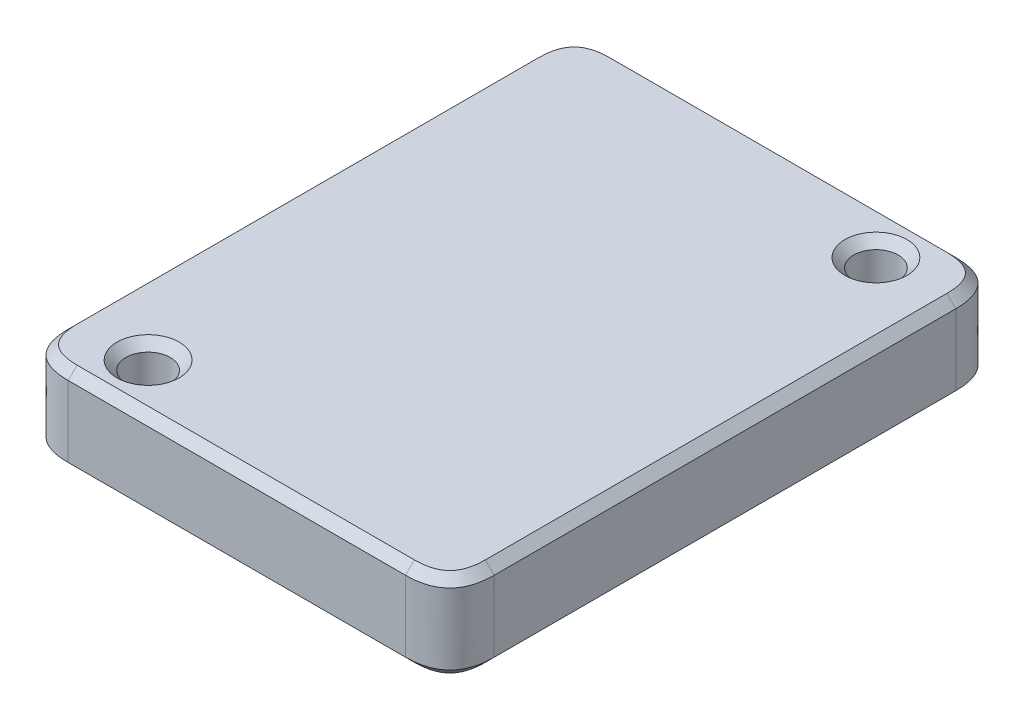
from build123d import *

# Parameters (mm, degrees)
SKETCH1_W                    = 48
SKETCH1_H                    = 62
BOSS_EXTRUDE1_DEPTH          = 10
SKETCH2_R                    = 3.5
CUT_EXTRUDE2_DEPTH           = 1
CUT_EXTRUDE2_DRAFT           = -45
CUT_EXTRUDE2_PROFILE_2_DEPTH = 1
CUT_EXTRUDE2_PROFILE_2_DRAFT = -45
SKETCH4_R                    = 3.5
CUT_EXTRUDE3_DEPTH           = 1
CUT_EXTRUDE3_DRAFT           = -45
CUT_EXTRUDE3_PROFILE_2_DEPTH = 1
CUT_EXTRUDE3_PROFILE_2_DRAFT = -45
SKETCH5_R                    = 2.5
CUT_EXTRUDE4_DEPTH           = 41.459856648
FILLET4_SIZE                 = 5
FILLET5_SIZE                 = 5
FILLET6_SIZE                 = 5
FILLET7_SIZE                 = 5
CHAMFER4_SIZE                = 1
CHAMFER5_SIZE                = 1


with BuildPart() as part:
    # Sketch1 → Boss-Extrude1 (new body)
    with BuildSketch(Plane(origin=(0, 0, 0), x_dir=(1, 0, 0), z_dir=(0, 1, 0))):
        Rectangle(SKETCH1_W, SKETCH1_H)
    extrude(amount=BOSS_EXTRUDE1_DEPTH)


with BuildPart() as cut_extrude2_tool:
    # Sketch2 → Cut-Extrude2 (with draft: the straight prism first)
    with BuildSketch(Plane(origin=(0, 10, 0), x_dir=(1, 0, 0), z_dir=(0, 1, 0))):
        with Locations((15.5, 25.5)):
            Circle(SKETCH2_R)
    extrude(amount=-CUT_EXTRUDE2_DEPTH)
    # Cut-Extrude2: the draft: its side faces are tilted about the plane it starts from
    cut_extrude2_sides = [cut_extrude2_tool.faces().sort_by_distance(p)[0] for p in [
        (12, 9.5, -25.5),
    ]]
    draft(cut_extrude2_sides, Plane(origin=(0, 10, 0), x_dir=(1, 0, 0), z_dir=(0, 1, 0)), CUT_EXTRUDE2_DRAFT)


with BuildPart() as part_1:
    add(part.part)

    # Cut-Extrude2: cut by cut_extrude2_tool
    add(cut_extrude2_tool.part, mode=Mode.SUBTRACT)


with BuildPart() as cut_extrude2_profile_2_tool:
    # Sketch2 → Cut-Extrude2 profile 2 (with draft: the straight prism first)
    with BuildSketch(Plane(origin=(0, 10, 0), x_dir=(1, 0, 0), z_dir=(0, 1, 0))):
        with Locations((-15.5, -25.5)):
            Circle(SKETCH2_R)
    extrude(amount=-CUT_EXTRUDE2_PROFILE_2_DEPTH)
    # Cut-Extrude2 profile 2: the draft: its side faces are tilted about the plane it starts from
    cut_extrude2_profile_2_sides = [cut_extrude2_profile_2_tool.faces().sort_by_distance(p)[0] for p in [
        (-19, 9.5, 25.5),
    ]]
    draft(cut_extrude2_profile_2_sides, Plane(origin=(0, 10, 0), x_dir=(1, 0, 0), z_dir=(0, 1, 0)), CUT_EXTRUDE2_PROFILE_2_DRAFT)


with BuildPart() as part_2:
    add(part_1.part)

    # Cut-Extrude2 profile 2: cut by cut_extrude2_profile_2_tool
    add(cut_extrude2_profile_2_tool.part, mode=Mode.SUBTRACT)


with BuildPart() as cut_extrude3_tool:
    # Sketch4 → Cut-Extrude3 (with draft: the straight prism first)
    with BuildSketch(Plane.XZ):
        with Locations((-15.5, 25.5)):
            Circle(SKETCH4_R)
    extrude(amount=-CUT_EXTRUDE3_DEPTH)
    # Cut-Extrude3: the draft: its side faces are tilted about the plane it starts from
    cut_extrude3_sides = [cut_extrude3_tool.faces().sort_by_distance(p)[0] for p in [
        (-19, 0.5, 25.5),
    ]]
    draft(cut_extrude3_sides, Plane.XZ, CUT_EXTRUDE3_DRAFT)


with BuildPart() as part_3:
    add(part_2.part)

    # Cut-Extrude3: cut by cut_extrude3_tool
    add(cut_extrude3_tool.part, mode=Mode.SUBTRACT)


with BuildPart() as cut_extrude3_profile_2_tool:
    # Sketch4 → Cut-Extrude3 profile 2 (with draft: the straight prism first)
    with BuildSketch(Plane.XZ):
        with Locations((15.5, -25.5)):
            Circle(SKETCH4_R)
    extrude(amount=-CUT_EXTRUDE3_PROFILE_2_DEPTH)
    # Cut-Extrude3 profile 2: the draft: its side faces are tilted about the plane it starts from
    cut_extrude3_profile_2_sides = [cut_extrude3_profile_2_tool.faces().sort_by_distance(p)[0] for p in [
        (12, 0.5, -25.5),
    ]]
    draft(cut_extrude3_profile_2_sides, Plane.XZ, CUT_EXTRUDE3_PROFILE_2_DRAFT)


with BuildPart() as part_4:
    add(part_3.part)

    # Cut-Extrude3 profile 2: cut by cut_extrude3_profile_2_tool
    add(cut_extrude3_profile_2_tool.part, mode=Mode.SUBTRACT)

    # Sketch5 → Cut-Extrude4 (cut, through all)
    with BuildSketch(Plane(origin=(0, 10, 0), x_dir=(1, 0, 0), z_dir=(0, 1, 0))):
        with Locations(Location((-15.5, -25.5, 0), (0, 0, 270))):
            Circle(SKETCH5_R)
        with Locations(Location((15.5, 25.5, 0), (0, 0, 270))):
            Circle(SKETCH5_R)
    extrude(amount=-CUT_EXTRUDE4_DEPTH, mode=Mode.SUBTRACT)

    # Fillet4
    # a fillet whose section is not a circle: 5 mm, written as the material it takes off along each edge
    with BuildSketch(Plane(origin=(-24, -12.5, -31), x_dir=(1, 0, 0), z_dir=(0, 1, 0))) as fillet4_piece_1:
        with BuildLine():
            Bezier((FILLET4_SIZE, 0), (0, 0), (0, -FILLET4_SIZE), weights=[1, 1, 1])
            Line((0, -FILLET4_SIZE), (0, 0))
            Line((0, 0), (FILLET4_SIZE, 0))
        make_face()
    extrude(amount=35, mode=Mode.SUBTRACT)

    # Fillet5
    # a fillet whose section is not a circle: 5 mm, written as the material it takes off along each edge
    with BuildSketch(Plane(origin=(24, -12.5, -31), x_dir=(-1, 0, 0), z_dir=(0, 1, 0))) as fillet5_piece_1:
        with BuildLine():
            Bezier((FILLET5_SIZE, 0), (0, 0), (0, FILLET5_SIZE), weights=[1, 1, 1])
            Line((0, FILLET5_SIZE), (0, 0))
            Line((0, 0), (FILLET5_SIZE, 0))
        make_face()
    extrude(amount=35, mode=Mode.SUBTRACT)

    # Fillet6
    # a fillet whose section is not a circle: 5 mm, written as the material it takes off along each edge
    with BuildSketch(Plane(origin=(24, -12.5, 31), x_dir=(-1, 0, 0), z_dir=(0, 1, 0))) as fillet6_piece_1:
        with BuildLine():
            Bezier((FILLET6_SIZE, 0), (0, 0), (0, -FILLET6_SIZE), weights=[1, 1, 1])
            Line((0, -FILLET6_SIZE), (0, 0))
            Line((0, 0), (FILLET6_SIZE, 0))
        make_face()
    extrude(amount=35, mode=Mode.SUBTRACT)

    # Fillet7
    # a fillet whose section is not a circle: 5 mm, written as the material it takes off along each edge
    with BuildSketch(Plane(origin=(-24, -12.5, 31), x_dir=(1, 0, 0), z_dir=(0, 1, 0))) as fillet7_piece_1:
        with BuildLine():
            Bezier((FILLET7_SIZE, 0), (0, 0), (0, FILLET7_SIZE), weights=[1, 1, 1])
            Line((0, FILLET7_SIZE), (0, 0))
            Line((0, 0), (FILLET7_SIZE, 0))
        make_face()
    extrude(amount=35, mode=Mode.SUBTRACT)

    # Chamfer4
    chamfer4_edges = [part_4.edges().sort_by_distance(p)[0] for p in [
        (-22.75, 10, -29.75),
        (0, 10, -31),
        (22.75, 10, -29.75),
        (24, 10, 0),
        (22.75, 10, 29.75),
        (0, 10, 31),
        (-22.75, 10, 29.75),
        (-24, 10, 0),
    ]]
    chamfer(chamfer4_edges, length=CHAMFER4_SIZE)

    # Chamfer5
    chamfer5_edges = [part_4.edges().sort_by_distance(p)[0] for p in [
        (-22.75, 0, 29.75),
        (-24, 0, 0),
        (-22.75, 0, -29.75),
        (0, 0, -31),
        (22.75, 0, -29.75),
        (24, 0, 0),
        (0, 0, 31),
        (22.75, 0, 29.75),
    ]]
    chamfer(chamfer5_edges, length=CHAMFER5_SIZE)


solid = part_4.part
